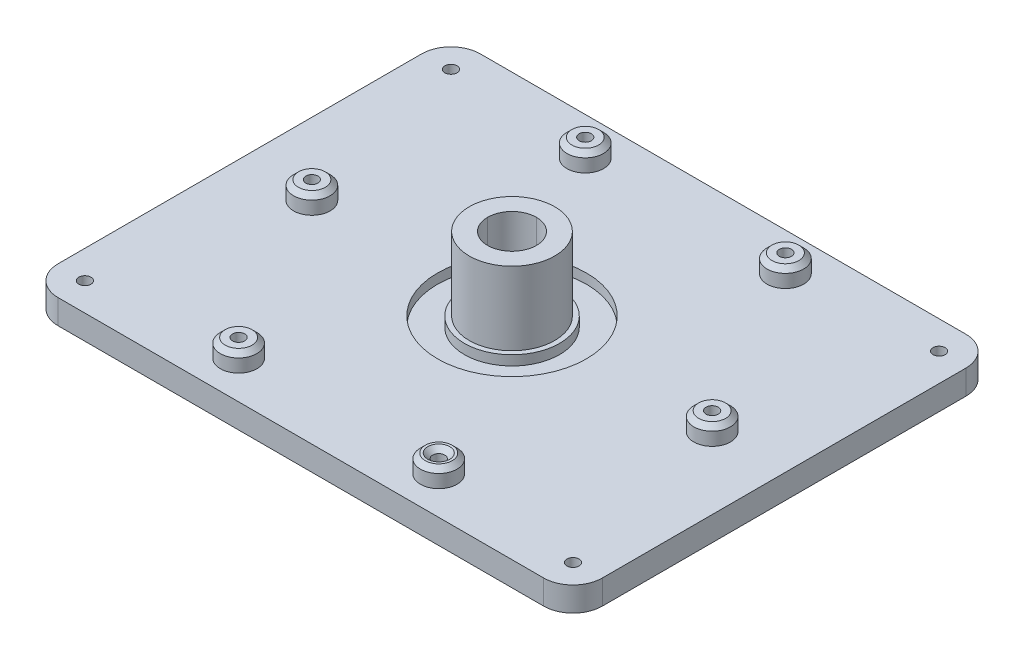
from build123d import *

# Parameters (mm, degrees)
SKETCH1_R           = 2.5
BOSS_EXTRUDE1_DEPTH = 10
SKETCH2_R           = 30.5
SKETCH2_R_2         = 19.5
CUT_EXTRUDE1_DEPTH  = 4
SKETCH3_R           = 17.5
BOSS_EXTRUDE2_DEPTH = 30
CUT_EXTRUDE2_DEPTH  = 10
FILLET1_R           = 10
SKETCH9_R           = 2.5
CUT_EXTRUDE4_DEPTH  = 20
BOSS_EXTRUDE3_START = 7.38
SKETCH10_R          = 7.5
SKETCH10_R_2        = 2.5
BOSS_EXTRUDE3_DEPTH = 7.38
CHAMFER1_SIZE       = 2


with BuildPart() as part:
    # Sketch1 → Boss-Extrude1 (new body)
    with BuildSketch(Plane(origin=(0, 0, 0), x_dir=(1, 0, 0), z_dir=(0, 1, 0))):
        with BuildLine():
            Line((-99.5, 86.5), (99.5, 86.5))
            ThreePointArc((99.5, 86.5), (107.985281374, 82.985281374), (111.5, 74.5))
            Line((111.5, 74.5), (111.5, -74.5))
            ThreePointArc((111.5, -74.5), (107.985281374, -82.985281374), (99.5, -86.5))
            Line((99.5, -86.5), (-99.5, -86.5))
            ThreePointArc((-99.5, -86.5), (-107.985281374, -82.985281374), (-111.5, -74.5))
            Line((-111.5, -74.5), (-111.5, 74.5))
            ThreePointArc((-111.5, 74.5), (-107.985281374, 82.985281374), (-99.5, 86.5))
        make_face()
        with Locations(Location((100, 75, 0), (0, 0, 270))):
            Circle(SKETCH1_R, mode=Mode.SUBTRACT)
        with Locations(Location((100, -75, 0), (0, 0, 270))):
            Circle(SKETCH1_R, mode=Mode.SUBTRACT)
        with Locations(Location((-100, -75, 0), (0, 0, 270))):
            Circle(SKETCH1_R, mode=Mode.SUBTRACT)
        with Locations(Location((-100, 75, 0), (0, 0, 270))):
            Circle(SKETCH1_R, mode=Mode.SUBTRACT)
    extrude(amount=-BOSS_EXTRUDE1_DEPTH)

    # Sketch2 → Cut-Extrude1 (cut)
    with BuildSketch(Plane(origin=(0, 0, 0), x_dir=(1, 0, 0), z_dir=(0, 1, 0))):
        with Locations(Location((0, 0, 0), (0, 0, 270))):
            Circle(SKETCH2_R)
        with Locations(Location((0, 0, 0), (0, 0, 270))):
            Circle(SKETCH2_R_2, mode=Mode.SUBTRACT)
    extrude(amount=-CUT_EXTRUDE1_DEPTH, mode=Mode.SUBTRACT)

    # Sketch3 → Boss-Extrude2 (add)
    with BuildSketch(Plane(origin=(0, 0, 0), x_dir=(1, 0, 0), z_dir=(0, 1, 0))):
        with Locations(Location((0, 0, 0), (0, 0, 270))):
            Circle(SKETCH3_R)
    extrude(amount=BOSS_EXTRUDE2_DEPTH)

    # Sketch6 → Cut-Extrude2 (cut, symmetric)
    with BuildSketch(Plane(origin=(0, 0, 0), x_dir=(0, 0, -1), z_dir=(1, 0, 0))):
        Polygon((-10, 30), (10, 30), (10, -10), (-10, -10), (-17.5, -10), (-10, -2.5), align=None)
    extrude(amount=CUT_EXTRUDE2_DEPTH, both=True, mode=Mode.SUBTRACT)

    # Fillet1
    fillet1_edges = [part.edges().sort_by_distance(p)[0] for p in [
        (10, 13.75, 10),
        (-10, 13.75, 10),
        (-10, 10, -10),
        (10, 10, -10),
    ]]
    fillet(fillet1_edges, radius=FILLET1_R - 0.0001)  # a hair under: the kernel refuses the full size

    # Sketch9 → Cut-Extrude4 (cut)
    with BuildSketch(Plane(origin=(0, 0, 0), x_dir=(1, 0, 0), z_dir=(0, 1, 0))):
        with Locations(Location((41, 71.01408311, 0), (0, 0, 270))):
            Circle(SKETCH9_R)
        with Locations(Location((82, 0, 0), (0, 0, 270))):
            Circle(SKETCH9_R)
        with Locations(Location((41, -71.01408311, 0), (0, 0, 270))):
            Circle(SKETCH9_R)
        with Locations(Location((-41, -71.01408311, 0), (0, 0, 270))):
            Circle(SKETCH9_R)
        with Locations(Location((-82, 0, 0), (0, 0, 270))):
            Circle(SKETCH9_R)
        with Locations(Location((-41, 71.01408311, 0), (0, 0, 270))):
            Circle(SKETCH9_R)
    extrude(amount=-CUT_EXTRUDE4_DEPTH, mode=Mode.SUBTRACT)

    # Sketch10 → Boss-Extrude3 (add)
    # profile 1 of 6: a face of its own
    with BuildSketch(Plane(origin=(0, 0, 0), x_dir=(1, 0, 0), z_dir=(0, 1, 0)).offset(BOSS_EXTRUDE3_START)):
        with Locations(Location((41, 71.01408311, 0), (0, 0, 270))):
            Circle(SKETCH10_R)
        with Locations(Location((41, 71.01408311, 0), (0, 0, 270))):
            Circle(SKETCH10_R_2, mode=Mode.SUBTRACT)
    # profile 2 of 6: a face of its own
    with BuildSketch(Plane(origin=(0, 0, 0), x_dir=(1, 0, 0), z_dir=(0, 1, 0)).offset(BOSS_EXTRUDE3_START)):
        with Locations(Location((82, 0, 0), (0, 0, 270))):
            Circle(SKETCH10_R)
        with Locations(Location((82, 0, 0), (0, 0, 270))):
            Circle(SKETCH10_R_2, mode=Mode.SUBTRACT)
    # profile 3 of 6: a face of its own
    with BuildSketch(Plane(origin=(0, 0, 0), x_dir=(1, 0, 0), z_dir=(0, 1, 0)).offset(BOSS_EXTRUDE3_START)):
        with Locations(Location((41, -71.01408311, 0), (0, 0, 270))):
            Circle(SKETCH10_R)
        with Locations(Location((41, -71.01408311, 0), (0, 0, 270))):
            Circle(SKETCH10_R_2, mode=Mode.SUBTRACT)
    # profile 4 of 6: a face of its own
    with BuildSketch(Plane(origin=(0, 0, 0), x_dir=(1, 0, 0), z_dir=(0, 1, 0)).offset(BOSS_EXTRUDE3_START)):
        with Locations(Location((-41, -71.01408311, 0), (0, 0, 270))):
            Circle(SKETCH10_R)
        with Locations(Location((-41, -71.01408311, 0), (0, 0, 270))):
            Circle(SKETCH10_R_2, mode=Mode.SUBTRACT)
    # profile 5 of 6: a face of its own
    with BuildSketch(Plane(origin=(0, 0, 0), x_dir=(1, 0, 0), z_dir=(0, 1, 0)).offset(BOSS_EXTRUDE3_START)):
        with Locations(Location((-82, 0, 0), (0, 0, 270))):
            Circle(SKETCH10_R)
        with Locations(Location((-82, 0, 0), (0, 0, 270))):
            Circle(SKETCH10_R_2, mode=Mode.SUBTRACT)
    # profile 6 of 6: a face of its own
    with BuildSketch(Plane(origin=(0, 0, 0), x_dir=(1, 0, 0), z_dir=(0, 1, 0)).offset(BOSS_EXTRUDE3_START)):
        with Locations(Location((-41, 71.01408311, 0), (0, 0, 270))):
            Circle(SKETCH10_R)
        with Locations(Location((-41, 71.01408311, 0), (0, 0, 270))):
            Circle(SKETCH10_R_2, mode=Mode.SUBTRACT)
    extrude(amount=-BOSS_EXTRUDE3_DEPTH)

    # Chamfer1
    chamfer1_edges = [part.edges().sort_by_distance(p)[0] for p in [
        (41, 7.38, -78.51408311),
        (82, 7.38, -7.5),
        (41, 7.38, 63.51408311),
        (41, 7.38, 68.51408311),
        (-41, 7.38, 63.51408311),
        (-82, 7.38, -7.5),
        (-41, 7.38, -78.51408311),
    ]]
    chamfer(chamfer1_edges, length=CHAMFER1_SIZE)


solid = part.part
